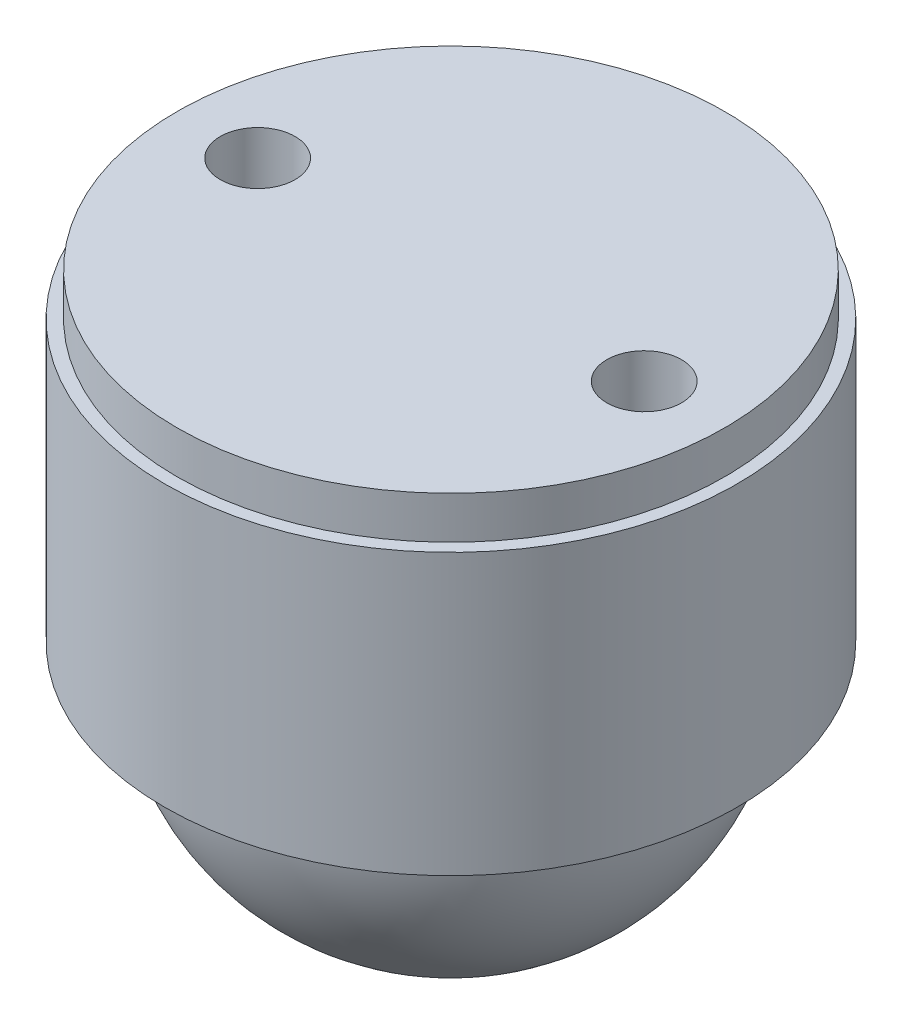
from build123d import *

# Parameters (mm, degrees)
SKETCH2_R           = 11.475
BOSS_EXTRUDE1_DEPTH = 11.225
SKETCH5_R           = 10.98
BOSS_EXTRUDE3_DEPTH = 1.7
SKETCH6_R           = 1.5
CUT_EXTRUDE4_DEPTH  = 5


with BuildPart() as part:
    # Sketch1 → Revolve1 (revolve)
    with BuildSketch(Plane(origin=(0, 0, 0), x_dir=(1, 0, 0), z_dir=(0, 1, 0))):
        with BuildLine():
            Line((0, 9.525), (0, -9.525))
            ThreePointArc((0, -9.525), (9.525, 0), (0, 9.525))
        make_face()
    revolve(axis=Axis((0, 0, -9.525), (0, 0, 1)))

    # Sketch2 → Boss-Extrude1 (add)
    with BuildSketch(Plane(origin=(0, 0, 0), x_dir=(1, 0, 0), z_dir=(0, 1, 0))):
        Circle(SKETCH2_R)
    extrude(amount=BOSS_EXTRUDE1_DEPTH)

    # Sketch5 → Boss-Extrude3 (add)
    with BuildSketch(Plane(origin=(0, 11.225, 0), x_dir=(1, 0, 0), z_dir=(0, 1, 0))):
        Circle(SKETCH5_R)
    extrude(amount=BOSS_EXTRUDE3_DEPTH)

    # Sketch6 → Cut-Extrude4 (cut)
    with BuildSketch(Plane(origin=(0, 12.925, 0), x_dir=(1, 0, 0), z_dir=(0, 1, 0))):
        with Locations((7.747, 0)):
            Circle(SKETCH6_R)
        with Locations((-7.747, 0)):
            Circle(SKETCH6_R)
    extrude(amount=-CUT_EXTRUDE4_DEPTH, mode=Mode.SUBTRACT)


solid = part.part
